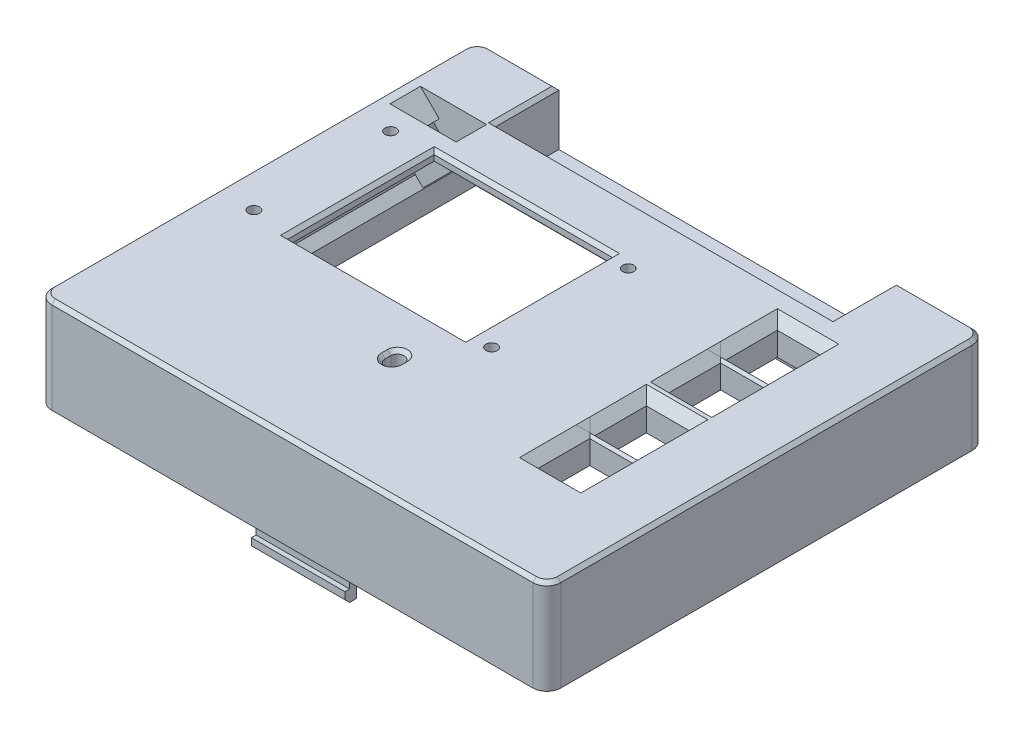
from build123d import *

# Parameters (mm, degrees)
SKETCH1_W            = 108.81
SKETCH1_H            = 93.91
BOSS_EXTRUDE1_DEPTH  = 3
SKETCH2_W            = 108.81
SKETCH2_H            = 93.91
SKETCH2_W_2          = 102.81
SKETCH2_H_2          = 87.91
BOSS_EXTRUDE2_DEPTH  = 17.259
BOSS_EXTRUDE3_DEPTH  = 10
CHAMFER1_SIZE        = 1
CUT_EXTRUDE1_REACH   = 123.742
SKETCH8_W            = 11.62
SKETCH8_H            = 53.615769541
BOSS_EXTRUDE4_DEPTH  = 7
SKETCH9_W            = 9.12
SKETCH9_H            = 11.025
CUT_EXTRUDE2_DEPTH   = 78.572798912
SKETCH10_W           = 72.135
SKETCH10_H           = 7.477
CUT_EXTRUDE3_DEPTH   = 78.572798912
SKETCH11_W           = 72.135
SKETCH11_H           = 6.0665
CUT_EXTRUDE4_DEPTH   = 11.716
CUT_EXTRUDE5_DEPTH   = 1.0495
SKETCH14_W           = 38.1
SKETCH14_H           = 31.3563
CUT_EXTRUDE6_DEPTH   = 78.572798912
BOSS_EXTRUDE5_DEPTH  = 1.7826
BOSS_EXTRUDE8_DEPTH  = 8.716
BOSS_EXTRUDE6_START  = -33.395
BOSS_EXTRUDE6_DEPTH  = 9
SKETCH17_W           = 9
SKETCH17_H           = 12.19950426
BOSS_EXTRUDE7_DEPTH  = 2
CUT_EXTRUDE7_DEPTH   = 104.117373354
CUT_EXTRUDE9_REACH   = 92.638
SKETCH20_W           = 6.5
SKETCH20_H           = 5.8
BOSS_EXTRUDE9_DEPTH  = 9.159
CUT_EXTRUDE10_DEPTH  = 78.572798912
CHAMFER2_SIZE        = 2
M2_CLEARANCE_HOLE1_D = 2.4
FILLET1_R            = 3
CHAMFER3_SIZE        = 0.75
CUT_EXTRUDE11_REACH  = 123.742
SKETCH26_W           = 38.225000066
SKETCH26_H           = 7.61
SKETCH27_W           = 6
SKETCH27_H           = 6.5
CUT_EXTRUDE12_DEPTH  = 78.572798912


# Read off the part's stored shape, not the designer's step: Boss-Extrude6
with BuildPart() as part:
    # Sketch1 → Boss-Extrude1 (new body)
    with BuildSketch(Plane(origin=(0, 27.869, 0), x_dir=(-1, 0, 0), z_dir=(0, -1, 0))):
        with Locations((-1, 0)):
            Rectangle(SKETCH1_W, SKETCH1_H)
    extrude(amount=BOSS_EXTRUDE1_DEPTH)

    # Sketch2 → Boss-Extrude2 (add)
    with BuildSketch(Plane.XZ.offset(-24.869)):
        with Locations((1, 0)):
            Rectangle(SKETCH2_W, SKETCH2_H)
        with Locations((1, 0)):
            Rectangle(SKETCH2_W_2, SKETCH2_H_2, mode=Mode.SUBTRACT)
    extrude(amount=BOSS_EXTRUDE2_DEPTH)

    # Sketch4 → Boss-Extrude3 (add, symmetric)
    with BuildSketch(Plane.ZY):
        Polygon((-43.955, 12.36), (-42.205, 10.61), (-42.205, 0.61), (-43.705, 0.61), (-44.705, 1.61), (-44.705, 3.11), (-43.705, 3.11), (-43.705, 7.61), (-43.955, 7.61), align=None)
    boss_extrude3 = extrude(amount=BOSS_EXTRUDE3_DEPTH, both=True)

    # Mirror1: Boss-Extrude3 across plane
    add(boss_extrude3.mirror(Plane.XY))

    # Sweep1: sweep along a path in Sketch6
    with BuildLine(Plane.XZ.offset(-7.61)) as sweep1_path:
        Line((52.405, -43.955), (52.405, 43.955))
        Line((52.405, 43.955), (-50.405, 43.955))
        Line((-50.405, 43.955), (-50.405, -43.955))
        Line((-50.405, -43.955), (52.405, -43.955))
    # Sketch5 → Sweep1 (sweep)
    with BuildSketch(Plane.ZY):
        Polygon((-43.955, 7.61), (-43.705, 7.61), (-43.705, 5.61), (-42.205, 5.61), (-42.205, 10.61), (-43.955, 12.36), align=None)
    sweep(path=sweep1_path.line, transition=Transition.RIGHT)

    # Chamfer1
    chamfer1_edges = [part.edges().sort_by_distance(p)[0] for p in [
        (31.0775, 5.61, -43.705),
        (31.0775, 5.61, 43.705),
        (52.155, 5.61, 0),
        (-30.0775, 5.61, -43.705),
        (-30.0775, 5.61, 43.705),
        (-50.155, 5.61, 0),
    ]]
    chamfer(chamfer1_edges, length=CHAMFER1_SIZE)

    # Sketch7 → Cut-Extrude1 (cut, up to next)
    with BuildSketch(Plane.ZY.offset(53.405), mode=Mode.PRIVATE) as cut_extrude1_sk1:
        with BuildLine():
            Line((17.410956444, 19.809997782), (23.975613479, 19.809997782))
            ThreePointArc((23.975613479, 19.809997782), (28.225611261, 15.56), (23.975613479, 11.310002218))
            Line((23.975613479, 11.310002218), (17.410956444, 11.310002218))
            ThreePointArc((17.410956444, 11.310002218), (13.160958662, 15.56), (17.410956444, 19.809997782))
        make_face()
    cut_extrude1_tool1 = extrude(cut_extrude1_sk1.sketch, amount=-CUT_EXTRUDE1_REACH, mode=Mode.PRIVATE) & part.part
    add(cut_extrude1_tool1.solids().sort_by_distance((-53.405, 15.56, 20.693285))[0], mode=Mode.SUBTRACT)

    # Sketch8 → Boss-Extrude4 (add)
    with BuildSketch(Plane(origin=(0, 27.869, 0), x_dir=(1, 0, 0), z_dir=(0, 1, 0))):
        with Locations((35.146783972, 1.567317421)):
            Rectangle(SKETCH8_W, SKETCH8_H)
    extrude(amount=-BOSS_EXTRUDE4_DEPTH)

    # Sketch9 → Cut-Extrude2 (cut, through all)
    with BuildSketch(Plane(origin=(0, 27.869, 0), x_dir=(1, 0, 0), z_dir=(0, 1, 0))):
        with Locations((35.146783972, 9.500245453)):
            Rectangle(SKETCH9_W, SKETCH9_H)
        with Locations((35.146783972, 21.612702191)):
            Rectangle(SKETCH9_W, SKETCH9_H)
        with Locations((35.146783972, -18.47806735)):
            Rectangle(SKETCH9_W, SKETCH9_H)
        with Locations((35.146783972, -6.378211363)):
            Rectangle(SKETCH9_W, SKETCH9_H)
    extrude(amount=-CUT_EXTRUDE2_DEPTH, mode=Mode.SUBTRACT)

    # Sketch10 → Cut-Extrude3 (cut, through all)
    with BuildSketch(Plane(origin=(0, 27.869, 0), x_dir=(1, 0, 0), z_dir=(0, 1, 0))):
        with Locations((0.125, 37.15)):
            Rectangle(SKETCH10_W, SKETCH10_H)
    extrude(amount=-CUT_EXTRUDE3_DEPTH, mode=Mode.SUBTRACT)

    # Sketch11 → Cut-Extrude4 (cut)
    with BuildSketch(Plane(origin=(0, 27.869, 0), x_dir=(1, 0, 0), z_dir=(0, 1, 0))):
        with Locations((0.125, 43.92175)):
            Rectangle(SKETCH11_W, SKETCH11_H)
    extrude(amount=-CUT_EXTRUDE4_DEPTH, mode=Mode.SUBTRACT)

    # Sketch13 → Cut-Extrude5 (cut)
    with BuildSketch(Plane.XZ.offset(-24.869)):
        Polygon((3.157, 12.11), (-45.3504, 12.11), (-45.3504, 7.3668), (-43.9341, 7.3668), (-43.9341, -19.4368), (-45.3504, -19.4368), (-45.3504, -24.18), (3.157, -24.18), align=None)
    extrude(amount=-CUT_EXTRUDE5_DEPTH, mode=Mode.SUBTRACT)

    # Sketch14 → Cut-Extrude6 (cut, through all)
    with BuildSketch(Plane(origin=(0, 27.869, 0), x_dir=(1, 0, 0), z_dir=(0, 1, 0))):
        with Locations((-18.29, 6.035)):
            Rectangle(SKETCH14_W, SKETCH14_H)
    extrude(amount=-CUT_EXTRUDE6_DEPTH, mode=Mode.SUBTRACT)

    # Sketch15 → Boss-Extrude5 (add)
    with BuildSketch(Plane.XZ.offset(-24.869)):
        with BuildLine():
            Line((-45.3504, 11.11), (-45.3504, 7.3668))
            Line((-45.3504, 7.3668), (-45.3504, -19.4368))
            Line((-45.3504, -19.4368), (-45.3504, -23.18))
            Line((-45.3504, -23.18), (-45.595, -23.18))
            ThreePointArc((-45.595, -23.18), (-47.391051224, -22.436051224), (-48.135, -20.64))
            Line((-48.135, -20.64), (-48.135, 8.57))
            ThreePointArc((-48.135, 8.57), (-47.391051224, 10.366051224), (-45.595, 11.11))
            Line((-45.595, 11.11), (-45.3504, 11.11))
        make_face()
        with BuildLine():
            Line((5.205, 11.11), (3.157, 11.11))
            Line((3.157, 11.11), (3.157, -23.18))
            Line((3.157, -23.18), (5.205, -23.18))
            ThreePointArc((5.205, -23.18), (7.001051224, -22.436051224), (7.745, -20.64))
            Line((7.745, -20.64), (7.745, 8.57))
            ThreePointArc((7.745, 8.57), (7.001051224, 10.366051224), (5.205, 11.11))
        make_face()
    extrude(amount=BOSS_EXTRUDE5_DEPTH)

    # Sketch21 → Boss-Extrude8 (add)
    with BuildSketch(Plane.XZ.offset(-24.869)):
        Polygon((-35.9425, -33.4115), (-35.9425, -43.955), (-37.9425, -43.955), (-37.9425, -31.4115), (38.1925, -31.4115), (38.1925, -43.955), (36.1925, -43.955), (36.1925, -33.4115), align=None)
    extrude(amount=BOSS_EXTRUDE8_DEPTH)

    # Boss-Extrude6 outline → Boss-Extrude6 (add)
    with BuildSketch(Plane.XY.offset(BOSS_EXTRUDE6_START)):
        Polygon((-50.195204379, 24.869), (-43.830013524, 18.503809145), (-37.464822668, 24.869), align=None)
    extrude(amount=BOSS_EXTRUDE6_DEPTH)

    # Sketch17 → Boss-Extrude7 (add)
    with BuildSketch(Plane(origin=(-31.166911334, 31.166911334, 0), x_dir=(0, 0, -1), z_dir=(0.7071067811865506, -0.7071067811865446, 0))):
        with Locations((28.895, -11.808578728)):
            Rectangle(SKETCH17_W, SKETCH17_H)
    extrude(amount=BOSS_EXTRUDE7_DEPTH)

    # Sketch18 → Cut-Extrude7 (cut, through all)
    with BuildSketch(Plane(origin=(-31.166911334, 31.166911334, 0), x_dir=(0, 0, -1), z_dir=(0.7071067811865509, -0.7071067811865442, 0))):
        Polygon((32.145, -14.658330858), (32.145, -6.158330858), (25.645, -6.158330858), (25.645, -14.658330858), (25.645, -16.158330858), (32.145, -16.158330858), align=None)
    extrude(amount=-CUT_EXTRUDE7_DEPTH, mode=Mode.SUBTRACT)

    # Sketch20 → Cut-Extrude9 (cut, up to next)
    with BuildSketch(Plane(origin=(-11.425665323, -11.425665323, 0), x_dir=(0, 0, -1), z_dir=(0.7071067811865442, 0.7071067811865508, 0)), mode=Mode.PRIVATE) as cut_extrude9_sk1:
        with Locations((28.895, 46.976668706)):
            Rectangle(SKETCH20_W, SKETCH20_H)
    cut_extrude9_tool1 = extrude(cut_extrude9_sk1.sketch, amount=-CUT_EXTRUDE9_REACH, mode=Mode.PRIVATE) & part.part
    add(cut_extrude9_tool1.solids().sort_by_distance((-44.643186, 21.791856, -28.895))[0], mode=Mode.SUBTRACT)

    # Sketch22 → Boss-Extrude9 (add)
    with BuildSketch(Plane(origin=(0, 27.869, 0), x_dir=(1, 0, 0), z_dir=(0, 1, 0))):
        with BuildLine():
            Line((0.078028502, -21.361475732), (0.083092707, -20.161486418))
            ThreePointArc((0.083092707, -20.161486418), (-3.328806796, -16.72066701), (-6.769626204, -20.132566513))
            Line((-6.769626204, -20.132566513), (-6.774690409, -21.332555827))
            ThreePointArc((-6.774690409, -21.332555827), (-3.362790906, -24.773375235), (0.078028502, -21.361475732))
        make_face()
    extrude(amount=-BOSS_EXTRUDE9_DEPTH)

    # Sketch23 → Cut-Extrude10 (cut, through all)
    with BuildSketch(Plane(origin=(0, 27.869, 0), x_dir=(1, 0, 0), z_dir=(0, 1, 0))):
        with BuildLine():
            Line((-1.921953688, -21.35303539), (-1.916889483, -20.153046075))
            ThreePointArc((-1.916889483, -20.153046075), (-3.337247138, -18.7206492), (-4.769644014, -20.141006856))
            Line((-4.769644014, -20.141006856), (-4.774708219, -21.34099617))
            ThreePointArc((-4.774708219, -21.34099617), (-3.354350564, -22.773393045), (-1.921953688, -21.35303539))
        make_face()
    extrude(amount=-CUT_EXTRUDE10_DEPTH, mode=Mode.SUBTRACT)

    # Chamfer2
    # the kernel refuses this chamfer: 2 mm, written as the material it takes off along each edge
    with BuildSketch(Plane(origin=(30.586783972, 27.869, -27.125202191), x_dir=(-0.9996219169112968, 0.027495876610585647, 0), z_dir=(0, 0, 1)), Plane(origin=(39.706783972, 27.869, -16.100202191), x_dir=(0.9996219169112968, 0.027495876610585647, 0), z_dir=(0, 0, -1)), Plane(origin=(30.586783972, 27.869, 12.96556735), x_dir=(-0.9996219169112968, 0.027495876610585647, 0), z_dir=(0, 0, 1)), Plane(origin=(39.706783972, 27.869, 23.99056735), x_dir=(0.9996219169112968, 0.027495876610585647, 0), z_dir=(0, 0, -1)), Plane(origin=(30.586783972, 27.869, 0.865711363), x_dir=(-0.9996219169112968, 0.027495876610585647, 0), z_dir=(0, 0, 1)), Plane(origin=(39.706783972, 27.869, 11.890711363), x_dir=(0.9996219169112968, 0.02749587661058392, 0), z_dir=(0, 0, -1)), Plane(origin=(39.706783972, 27.869, -3.987745453), x_dir=(0.9996219169112968, 0.027495876610585647, 0), z_dir=(0, 0, -1)), Plane(origin=(30.586783972, 27.869, -15.012745453), x_dir=(-0.9996219169112968, 0.027495876610585647, 0), z_dir=(0, 0, 1))) as chamfer2_piece_1:
        Polygon((CHAMFER2_SIZE * 0.999621916911, CHAMFER2_SIZE * 0.0274958766106), (-CHAMFER2_SIZE * 0.0274958766106, CHAMFER2_SIZE * 0.999621916911), (0, 0), align=None)
    extrude(amount=11.025, mode=Mode.SUBTRACT)
    with BuildSketch(Plane(origin=(30.586783972, 27.869, -27.125202191), x_dir=(-0.9996219169112968, 0.027495876610585647, 0), z_dir=(0, 0, 1))) as chamfer2_piece_2_section:
        Polygon((CHAMFER2_SIZE * 0.999621916911, CHAMFER2_SIZE * 0.0274958766106), (-CHAMFER2_SIZE * 0.0274958766106, CHAMFER2_SIZE * 0.999621916911), (0, 0), align=None)
    chamfer2_piece_2 = extrude(amount=16.168365976, mode=Mode.PRIVATE)
    chamfer2_piece_2 = split(chamfer2_piece_2, bisect_by=Plane(origin=(29.927196718, 27.209412746, -15.012745453), z_dir=(0, 0, 1)), keep=Keep.TOP, mode=Mode.PRIVATE)
    add(chamfer2_piece_2, mode=Mode.SUBTRACT)
    with BuildSketch(Plane(origin=(30.586783972, 27.869, -16.100202191), x_dir=(0, 0.027495876610585623, 0.9996219169112968), z_dir=(1, 0, 0)), Plane(origin=(39.706783972, 27.869, -27.125202191), x_dir=(0, 0.027495876610585696, -0.9996219169112968), z_dir=(-1, 0, 0)), Plane(origin=(30.586783972, 27.869, 23.99056735), x_dir=(0, 0.0274958766105856, 0.9996219169112968), z_dir=(1, 0, 0)), Plane(origin=(39.706783972, 27.869, 12.96556735), x_dir=(0, 0.02749587661058735, -0.9996219169112968), z_dir=(-1, 0, 0)), Plane(origin=(30.586783972, 27.869, 11.890711363), x_dir=(0, 0.027495876610583895, 0.9996219169112968), z_dir=(1, 0, 0)), Plane(origin=(39.706783972, 27.869, 0.865711363), x_dir=(0, 0.027495876610585623, -0.9996219169112968), z_dir=(-1, 0, 0)), Plane(origin=(30.586783972, 27.869, -3.987745453), x_dir=(0, 0.027495876610585623, 0.9996219169112968), z_dir=(1, 0, 0)), Plane(origin=(39.706783972, 27.869, -15.012745453), x_dir=(0, 0.027495876610585716, -0.9996219169112968), z_dir=(-1, 0, 0))) as chamfer2_piece_3:
        Polygon((CHAMFER2_SIZE * 0.999621916911, CHAMFER2_SIZE * 0.0274958766106), (-CHAMFER2_SIZE * 0.0274958766106, CHAMFER2_SIZE * 0.999621916911), (0, 0), align=None)
    extrude(amount=9.12, mode=Mode.SUBTRACT)
    with BuildSketch(Plane(origin=(39.706783972, 27.869, -10.956836215), x_dir=(0.9996219169112968, 0.027495876610585647, 0), z_dir=(0, 0, -1))) as chamfer2_piece_4_section:
        Polygon((CHAMFER2_SIZE * 0.999621916911, CHAMFER2_SIZE * 0.0274958766106), (-CHAMFER2_SIZE * 0.0274958766106, CHAMFER2_SIZE * 0.999621916911), (0, 0), align=None)
    chamfer2_piece_4 = extrude(amount=16.168365976, mode=Mode.PRIVATE)
    chamfer2_piece_4 = split(chamfer2_piece_4, bisect_by=Plane(origin=(40.366371226, 27.209412746, -15.012745453), z_dir=(0, 0, 1)), keep=Keep.TOP, mode=Mode.PRIVATE)
    add(chamfer2_piece_4, mode=Mode.SUBTRACT)
    with BuildSketch(Plane(origin=(30.586783972, 27.869, 7.822201374), x_dir=(-0.9996219169112968, 0.027495876610585647, 0), z_dir=(0, 0, 1))) as chamfer2_piece_5_section:
        Polygon((CHAMFER2_SIZE * 0.999621916911, CHAMFER2_SIZE * 0.0274958766106), (-CHAMFER2_SIZE * 0.0274958766106, CHAMFER2_SIZE * 0.999621916911), (0, 0), align=None)
    chamfer2_piece_5 = extrude(amount=16.168365976, mode=Mode.PRIVATE)
    chamfer2_piece_5 = split(chamfer2_piece_5, bisect_by=Plane(origin=(29.927196718, 27.209412746, 11.890711363), z_dir=(0, 0, -1)), keep=Keep.TOP, mode=Mode.PRIVATE)
    add(chamfer2_piece_5, mode=Mode.SUBTRACT)
    with BuildSketch(Plane(origin=(39.706783972, 27.869, 23.99056735), x_dir=(0.9996219169112968, 0.027495876610585647, 0), z_dir=(0, 0, -1))) as chamfer2_piece_6_section:
        Polygon((CHAMFER2_SIZE * 0.999621916911, CHAMFER2_SIZE * 0.0274958766106), (-CHAMFER2_SIZE * 0.0274958766106, CHAMFER2_SIZE * 0.999621916911), (0, 0), align=None)
    chamfer2_piece_6 = extrude(amount=16.168365976, mode=Mode.PRIVATE)
    chamfer2_piece_6 = split(chamfer2_piece_6, bisect_by=Plane(origin=(40.366371226, 27.209412746, 11.890711363), z_dir=(0, 0, -1)), keep=Keep.TOP, mode=Mode.PRIVATE)
    add(chamfer2_piece_6, mode=Mode.SUBTRACT)
    with BuildSketch(Plane(origin=(30.586783972, 27.869, -4.277654613), x_dir=(-0.9996219169112968, 0.027495876610585647, 0), z_dir=(0, 0, 1))) as chamfer2_piece_7_section:
        Polygon((CHAMFER2_SIZE * 0.999621916911, CHAMFER2_SIZE * 0.0274958766106), (-CHAMFER2_SIZE * 0.0274958766106, CHAMFER2_SIZE * 0.999621916911), (0, 0), align=None)
    chamfer2_piece_7 = extrude(amount=16.168365976, mode=Mode.PRIVATE)
    chamfer2_piece_7 = split(chamfer2_piece_7, bisect_by=Plane(origin=(29.927196718, 27.209412746, -3.987745453), z_dir=(0, 0, -1)), keep=Keep.TOP, mode=Mode.PRIVATE)
    add(chamfer2_piece_7, mode=Mode.SUBTRACT)
    with BuildSketch(Plane(origin=(30.586783972, 27.869, 0.865711363), x_dir=(-0.9996219169112968, 0.027495876610585647, 0), z_dir=(0, 0, 1))) as chamfer2_piece_8_section:
        Polygon((CHAMFER2_SIZE * 0.999621916911, CHAMFER2_SIZE * 0.0274958766106), (-CHAMFER2_SIZE * 0.0274958766106, CHAMFER2_SIZE * 0.999621916911), (0, 0), align=None)
    chamfer2_piece_8 = extrude(amount=16.168365976, mode=Mode.PRIVATE)
    chamfer2_piece_8 = split(chamfer2_piece_8, bisect_by=Plane(origin=(29.927196718, 27.209412746, 12.96556735), z_dir=(0, 0, 1)), keep=Keep.TOP, mode=Mode.PRIVATE)
    add(chamfer2_piece_8, mode=Mode.SUBTRACT)
    with BuildSketch(Plane(origin=(39.706783972, 27.869, 17.034077339), x_dir=(0.9996219169112968, 0.027495876610585647, 0), z_dir=(0, 0, -1))) as chamfer2_piece_9_section:
        Polygon((CHAMFER2_SIZE * 0.999621916911, CHAMFER2_SIZE * 0.0274958766106), (-CHAMFER2_SIZE * 0.0274958766106, CHAMFER2_SIZE * 0.999621916911), (0, 0), align=None)
    chamfer2_piece_9 = extrude(amount=16.168365976, mode=Mode.PRIVATE)
    chamfer2_piece_9 = split(chamfer2_piece_9, bisect_by=Plane(origin=(40.366371226, 27.209412746, 12.96556735), z_dir=(0, 0, 1)), keep=Keep.TOP, mode=Mode.PRIVATE)
    add(chamfer2_piece_9, mode=Mode.SUBTRACT)
    with BuildSketch(Plane(origin=(39.706783972, 27.869, 11.890711363), x_dir=(0.9996219169112968, 0.02749587661058392, 0), z_dir=(0, 0, -1))) as chamfer2_piece_10_section:
        Polygon((CHAMFER2_SIZE * 0.999621916911, CHAMFER2_SIZE * 0.0274958766106), (-CHAMFER2_SIZE * 0.0274958766106, CHAMFER2_SIZE * 0.999621916911), (0, 0), align=None)
    chamfer2_piece_10 = extrude(amount=16.168365976, mode=Mode.PRIVATE)
    chamfer2_piece_10 = split(chamfer2_piece_10, bisect_by=Plane(origin=(40.366371226, 27.209412746, -3.987745453), z_dir=(0, 0, -1)), keep=Keep.TOP, mode=Mode.PRIVATE)
    add(chamfer2_piece_10, mode=Mode.SUBTRACT)
    with BuildSketch(Plane(origin=(39.706783972, 27.869, 1.155620523), x_dir=(0.9996219169112968, 0.027495876610585647, 0), z_dir=(0, 0, -1))) as chamfer2_piece_11_section:
        Polygon((CHAMFER2_SIZE * 0.999621916911, CHAMFER2_SIZE * 0.0274958766106), (-CHAMFER2_SIZE * 0.0274958766106, CHAMFER2_SIZE * 0.999621916911), (0, 0), align=None)
    chamfer2_piece_11 = extrude(amount=16.168365976, mode=Mode.PRIVATE)
    chamfer2_piece_11 = split(chamfer2_piece_11, bisect_by=Plane(origin=(40.366371226, 27.209412746, 0.865711363), z_dir=(0, 0, 1)), keep=Keep.TOP, mode=Mode.PRIVATE)
    add(chamfer2_piece_11, mode=Mode.SUBTRACT)
    with BuildSketch(Plane(origin=(39.706783972, 27.869, -3.987745453), x_dir=(0.9996219169112968, 0.027495876610585647, 0), z_dir=(0, 0, -1))) as chamfer2_piece_12_section:
        Polygon((CHAMFER2_SIZE * 0.999621916911, CHAMFER2_SIZE * 0.0274958766106), (-CHAMFER2_SIZE * 0.0274958766106, CHAMFER2_SIZE * 0.999621916911), (0, 0), align=None)
    chamfer2_piece_12 = extrude(amount=16.168365976, mode=Mode.PRIVATE)
    chamfer2_piece_12 = split(chamfer2_piece_12, bisect_by=Plane(origin=(40.366371226, 27.209412746, -16.100202191), z_dir=(0, 0, -1)), keep=Keep.TOP, mode=Mode.PRIVATE)
    add(chamfer2_piece_12, mode=Mode.SUBTRACT)
    with BuildSketch(Plane(origin=(30.586783972, 27.869, -20.156111429), x_dir=(-0.9996219169112968, 0.027495876610585647, 0), z_dir=(0, 0, 1))) as chamfer2_piece_13_section:
        Polygon((CHAMFER2_SIZE * 0.999621916911, CHAMFER2_SIZE * 0.0274958766106), (-CHAMFER2_SIZE * 0.0274958766106, CHAMFER2_SIZE * 0.999621916911), (0, 0), align=None)
    chamfer2_piece_13 = extrude(amount=16.168365976, mode=Mode.PRIVATE)
    chamfer2_piece_13 = split(chamfer2_piece_13, bisect_by=Plane(origin=(29.927196718, 27.209412746, -16.100202191), z_dir=(0, 0, -1)), keep=Keep.TOP, mode=Mode.PRIVATE)
    add(chamfer2_piece_13, mode=Mode.SUBTRACT)
    with BuildSketch(Plane(origin=(30.586783972, 27.869, -15.012745453), x_dir=(-0.9996219169112968, 0.027495876610585647, 0), z_dir=(0, 0, 1))) as chamfer2_piece_14_section:
        Polygon((CHAMFER2_SIZE * 0.999621916911, CHAMFER2_SIZE * 0.0274958766106), (-CHAMFER2_SIZE * 0.0274958766106, CHAMFER2_SIZE * 0.999621916911), (0, 0), align=None)
    chamfer2_piece_14 = extrude(amount=16.168365976, mode=Mode.PRIVATE)
    chamfer2_piece_14 = split(chamfer2_piece_14, bisect_by=Plane(origin=(29.927196718, 27.209412746, 0.865711363), z_dir=(0, 0, 1)), keep=Keep.TOP, mode=Mode.PRIVATE)
    add(chamfer2_piece_14, mode=Mode.SUBTRACT)
    with BuildSketch(Plane(origin=(30.586783972, 27.869, -32.268568167), x_dir=(-0.9996219169112968, 0.027495876610585647, 0), z_dir=(0, 0, 1))) as chamfer2_piece_15a_section:
        Polygon((CHAMFER2_SIZE * 0.999621916911, CHAMFER2_SIZE * 0.0274958766106), (-CHAMFER2_SIZE * 0.0274958766106, CHAMFER2_SIZE * 0.999621916911), (0, 0), align=None)
    chamfer2_piece_15a = extrude(amount=16.168365976, mode=Mode.PRIVATE)
    chamfer2_piece_15a = split(chamfer2_piece_15a, bisect_by=Plane(origin=(29.927196718, 27.209412746, -27.125202191), z_dir=(0, 0, -1)), keep=Keep.TOP, mode=Mode.PRIVATE)
    with BuildSketch(Plane(origin=(39.706783972, 27.869, -27.125202191), x_dir=(0, 0.027495876610585696, -0.9996219169112968), z_dir=(-1, 0, 0))) as chamfer2_piece_15b_section:
        Polygon((CHAMFER2_SIZE * 0.999621916911, CHAMFER2_SIZE * 0.0274958766106), (-CHAMFER2_SIZE * 0.0274958766106, CHAMFER2_SIZE * 0.999621916911), (0, 0), align=None)
    chamfer2_piece_15b = extrude(amount=14.263365976, mode=Mode.PRIVATE)
    chamfer2_piece_15b = split(chamfer2_piece_15b, bisect_by=Plane(origin=(30.586783972, 27.209412746, -27.784789445), z_dir=(-1, 0, 0)), keep=Keep.TOP, mode=Mode.PRIVATE)
    chamfer2_piece_15 = chamfer2_piece_15a & chamfer2_piece_15b
    add(chamfer2_piece_15, mode=Mode.SUBTRACT)
    with BuildSketch(Plane(origin=(25.443417996, 27.869, -16.100202191), x_dir=(0, 0.027495876610585623, 0.9996219169112968), z_dir=(1, 0, 0))) as chamfer2_piece_16a_section:
        Polygon((CHAMFER2_SIZE * 0.999621916911, CHAMFER2_SIZE * 0.0274958766106), (-CHAMFER2_SIZE * 0.0274958766106, CHAMFER2_SIZE * 0.999621916911), (0, 0), align=None)
    chamfer2_piece_16a = extrude(amount=14.263365976, mode=Mode.PRIVATE)
    chamfer2_piece_16a = split(chamfer2_piece_16a, bisect_by=Plane(origin=(30.586783972, 27.209412746, -15.440614938), z_dir=(-1, 0, 0)), keep=Keep.TOP, mode=Mode.PRIVATE)
    with BuildSketch(Plane(origin=(30.586783972, 27.869, -27.125202191), x_dir=(-0.9996219169112968, 0.027495876610585647, 0), z_dir=(0, 0, 1))) as chamfer2_piece_16b_section:
        Polygon((CHAMFER2_SIZE * 0.999621916911, CHAMFER2_SIZE * 0.0274958766106), (-CHAMFER2_SIZE * 0.0274958766106, CHAMFER2_SIZE * 0.999621916911), (0, 0), align=None)
    chamfer2_piece_16b = extrude(amount=16.168365976, mode=Mode.PRIVATE)
    chamfer2_piece_16b = split(chamfer2_piece_16b, bisect_by=Plane(origin=(29.927196718, 27.209412746, -15.012745453), z_dir=(0, 0, -1)), keep=Keep.TOP, mode=Mode.PRIVATE)
    chamfer2_piece_16b = split(chamfer2_piece_16b, bisect_by=Plane(origin=(29.927196718, 27.209412746, -16.100202191), z_dir=(0, 0, 1)), keep=Keep.TOP, mode=Mode.PRIVATE)
    chamfer2_piece_16 = chamfer2_piece_16a & chamfer2_piece_16b
    add(chamfer2_piece_16, mode=Mode.SUBTRACT)
    with BuildSketch(Plane(origin=(30.586783972, 27.869, -16.100202191), x_dir=(0, 0.027495876610585623, 0.9996219169112968), z_dir=(1, 0, 0))) as chamfer2_piece_17a_section:
        Polygon((CHAMFER2_SIZE * 0.999621916911, CHAMFER2_SIZE * 0.0274958766106), (-CHAMFER2_SIZE * 0.0274958766106, CHAMFER2_SIZE * 0.999621916911), (0, 0), align=None)
    chamfer2_piece_17a = extrude(amount=14.263365976, mode=Mode.PRIVATE)
    chamfer2_piece_17a = split(chamfer2_piece_17a, bisect_by=Plane(origin=(39.706783972, 27.209412746, -15.440614938), z_dir=(1, 0, 0)), keep=Keep.TOP, mode=Mode.PRIVATE)
    with BuildSketch(Plane(origin=(39.706783972, 27.869, -10.956836215), x_dir=(0.9996219169112968, 0.027495876610585647, 0), z_dir=(0, 0, -1))) as chamfer2_piece_17b_section:
        Polygon((CHAMFER2_SIZE * 0.999621916911, CHAMFER2_SIZE * 0.0274958766106), (-CHAMFER2_SIZE * 0.0274958766106, CHAMFER2_SIZE * 0.999621916911), (0, 0), align=None)
    chamfer2_piece_17b = extrude(amount=16.168365976, mode=Mode.PRIVATE)
    chamfer2_piece_17b = split(chamfer2_piece_17b, bisect_by=Plane(origin=(40.366371226, 27.209412746, -15.012745453), z_dir=(0, 0, -1)), keep=Keep.TOP, mode=Mode.PRIVATE)
    chamfer2_piece_17b = split(chamfer2_piece_17b, bisect_by=Plane(origin=(40.366371226, 27.209412746, -16.100202191), z_dir=(0, 0, 1)), keep=Keep.TOP, mode=Mode.PRIVATE)
    chamfer2_piece_17 = chamfer2_piece_17a & chamfer2_piece_17b
    add(chamfer2_piece_17, mode=Mode.SUBTRACT)
    with BuildSketch(Plane(origin=(39.706783972, 27.869, -16.100202191), x_dir=(0.9996219169112968, 0.027495876610585647, 0), z_dir=(0, 0, -1))) as chamfer2_piece_18a_section:
        Polygon((CHAMFER2_SIZE * 0.999621916911, CHAMFER2_SIZE * 0.0274958766106), (-CHAMFER2_SIZE * 0.0274958766106, CHAMFER2_SIZE * 0.999621916911), (0, 0), align=None)
    chamfer2_piece_18a = extrude(amount=16.168365976, mode=Mode.PRIVATE)
    chamfer2_piece_18a = split(chamfer2_piece_18a, bisect_by=Plane(origin=(40.366371226, 27.209412746, -27.125202191), z_dir=(0, 0, -1)), keep=Keep.TOP, mode=Mode.PRIVATE)
    with BuildSketch(Plane(origin=(44.850149948, 27.869, -27.125202191), x_dir=(0, 0.027495876610585696, -0.9996219169112968), z_dir=(-1, 0, 0))) as chamfer2_piece_18b_section:
        Polygon((CHAMFER2_SIZE * 0.999621916911, CHAMFER2_SIZE * 0.0274958766106), (-CHAMFER2_SIZE * 0.0274958766106, CHAMFER2_SIZE * 0.999621916911), (0, 0), align=None)
    chamfer2_piece_18b = extrude(amount=14.263365976, mode=Mode.PRIVATE)
    chamfer2_piece_18b = split(chamfer2_piece_18b, bisect_by=Plane(origin=(39.706783972, 27.209412746, -27.784789445), z_dir=(1, 0, 0)), keep=Keep.TOP, mode=Mode.PRIVATE)
    chamfer2_piece_18 = chamfer2_piece_18a & chamfer2_piece_18b
    add(chamfer2_piece_18, mode=Mode.SUBTRACT)
    with BuildSketch(Plane(origin=(30.586783972, 27.869, 7.822201374), x_dir=(-0.9996219169112968, 0.027495876610585647, 0), z_dir=(0, 0, 1))) as chamfer2_piece_19a_section:
        Polygon((CHAMFER2_SIZE * 0.999621916911, CHAMFER2_SIZE * 0.0274958766106), (-CHAMFER2_SIZE * 0.0274958766106, CHAMFER2_SIZE * 0.999621916911), (0, 0), align=None)
    chamfer2_piece_19a = extrude(amount=16.168365976, mode=Mode.PRIVATE)
    chamfer2_piece_19a = split(chamfer2_piece_19a, bisect_by=Plane(origin=(29.927196718, 27.209412746, 12.96556735), z_dir=(0, 0, -1)), keep=Keep.TOP, mode=Mode.PRIVATE)
    chamfer2_piece_19a = split(chamfer2_piece_19a, bisect_by=Plane(origin=(29.927196718, 27.209412746, 11.890711363), z_dir=(0, 0, 1)), keep=Keep.TOP, mode=Mode.PRIVATE)
    with BuildSketch(Plane(origin=(39.706783972, 27.869, 12.96556735), x_dir=(0, 0.02749587661058735, -0.9996219169112968), z_dir=(-1, 0, 0))) as chamfer2_piece_19b_section:
        Polygon((CHAMFER2_SIZE * 0.999621916911, CHAMFER2_SIZE * 0.0274958766106), (-CHAMFER2_SIZE * 0.0274958766106, CHAMFER2_SIZE * 0.999621916911), (0, 0), align=None)
    chamfer2_piece_19b = extrude(amount=14.263365976, mode=Mode.PRIVATE)
    chamfer2_piece_19b = split(chamfer2_piece_19b, bisect_by=Plane(origin=(30.586783972, 27.209412746, 12.305980096), z_dir=(-1, 0, 0)), keep=Keep.TOP, mode=Mode.PRIVATE)
    chamfer2_piece_19 = chamfer2_piece_19a & chamfer2_piece_19b
    add(chamfer2_piece_19, mode=Mode.SUBTRACT)
    with BuildSketch(Plane(origin=(25.443417996, 27.869, 23.99056735), x_dir=(0, 0.0274958766105856, 0.9996219169112968), z_dir=(1, 0, 0))) as chamfer2_piece_20a_section:
        Polygon((CHAMFER2_SIZE * 0.999621916911, CHAMFER2_SIZE * 0.0274958766106), (-CHAMFER2_SIZE * 0.0274958766106, CHAMFER2_SIZE * 0.999621916911), (0, 0), align=None)
    chamfer2_piece_20a = extrude(amount=14.263365976, mode=Mode.PRIVATE)
    chamfer2_piece_20a = split(chamfer2_piece_20a, bisect_by=Plane(origin=(30.586783972, 27.209412746, 24.650154603), z_dir=(-1, 0, 0)), keep=Keep.TOP, mode=Mode.PRIVATE)
    with BuildSketch(Plane(origin=(30.586783972, 27.869, 12.96556735), x_dir=(-0.9996219169112968, 0.027495876610585647, 0), z_dir=(0, 0, 1))) as chamfer2_piece_20b_section:
        Polygon((CHAMFER2_SIZE * 0.999621916911, CHAMFER2_SIZE * 0.0274958766106), (-CHAMFER2_SIZE * 0.0274958766106, CHAMFER2_SIZE * 0.999621916911), (0, 0), align=None)
    chamfer2_piece_20b = extrude(amount=16.168365976, mode=Mode.PRIVATE)
    chamfer2_piece_20b = split(chamfer2_piece_20b, bisect_by=Plane(origin=(29.927196718, 27.209412746, 23.99056735), z_dir=(0, 0, 1)), keep=Keep.TOP, mode=Mode.PRIVATE)
    chamfer2_piece_20 = chamfer2_piece_20a & chamfer2_piece_20b
    add(chamfer2_piece_20, mode=Mode.SUBTRACT)
    with BuildSketch(Plane(origin=(30.586783972, 27.869, 23.99056735), x_dir=(0, 0.0274958766105856, 0.9996219169112968), z_dir=(1, 0, 0))) as chamfer2_piece_21a_section:
        Polygon((CHAMFER2_SIZE * 0.999621916911, CHAMFER2_SIZE * 0.0274958766106), (-CHAMFER2_SIZE * 0.0274958766106, CHAMFER2_SIZE * 0.999621916911), (0, 0), align=None)
    chamfer2_piece_21a = extrude(amount=14.263365976, mode=Mode.PRIVATE)
    chamfer2_piece_21a = split(chamfer2_piece_21a, bisect_by=Plane(origin=(39.706783972, 27.209412746, 24.650154603), z_dir=(1, 0, 0)), keep=Keep.TOP, mode=Mode.PRIVATE)
    with BuildSketch(Plane(origin=(39.706783972, 27.869, 29.133933326), x_dir=(0.9996219169112968, 0.027495876610585647, 0), z_dir=(0, 0, -1))) as chamfer2_piece_21b_section:
        Polygon((CHAMFER2_SIZE * 0.999621916911, CHAMFER2_SIZE * 0.0274958766106), (-CHAMFER2_SIZE * 0.0274958766106, CHAMFER2_SIZE * 0.999621916911), (0, 0), align=None)
    chamfer2_piece_21b = extrude(amount=16.168365976, mode=Mode.PRIVATE)
    chamfer2_piece_21b = split(chamfer2_piece_21b, bisect_by=Plane(origin=(40.366371226, 27.209412746, 23.99056735), z_dir=(0, 0, 1)), keep=Keep.TOP, mode=Mode.PRIVATE)
    chamfer2_piece_21 = chamfer2_piece_21a & chamfer2_piece_21b
    add(chamfer2_piece_21, mode=Mode.SUBTRACT)
    with BuildSketch(Plane(origin=(39.706783972, 27.869, 23.99056735), x_dir=(0.9996219169112968, 0.027495876610585647, 0), z_dir=(0, 0, -1))) as chamfer2_piece_22a_section:
        Polygon((CHAMFER2_SIZE * 0.999621916911, CHAMFER2_SIZE * 0.0274958766106), (-CHAMFER2_SIZE * 0.0274958766106, CHAMFER2_SIZE * 0.999621916911), (0, 0), align=None)
    chamfer2_piece_22a = extrude(amount=16.168365976, mode=Mode.PRIVATE)
    chamfer2_piece_22a = split(chamfer2_piece_22a, bisect_by=Plane(origin=(40.366371226, 27.209412746, 12.96556735), z_dir=(0, 0, -1)), keep=Keep.TOP, mode=Mode.PRIVATE)
    chamfer2_piece_22a = split(chamfer2_piece_22a, bisect_by=Plane(origin=(40.366371226, 27.209412746, 11.890711363), z_dir=(0, 0, 1)), keep=Keep.TOP, mode=Mode.PRIVATE)
    with BuildSketch(Plane(origin=(44.850149948, 27.869, 12.96556735), x_dir=(0, 0.02749587661058735, -0.9996219169112968), z_dir=(-1, 0, 0))) as chamfer2_piece_22b_section:
        Polygon((CHAMFER2_SIZE * 0.999621916911, CHAMFER2_SIZE * 0.0274958766106), (-CHAMFER2_SIZE * 0.0274958766106, CHAMFER2_SIZE * 0.999621916911), (0, 0), align=None)
    chamfer2_piece_22b = extrude(amount=14.263365976, mode=Mode.PRIVATE)
    chamfer2_piece_22b = split(chamfer2_piece_22b, bisect_by=Plane(origin=(39.706783972, 27.209412746, 12.305980096), z_dir=(1, 0, 0)), keep=Keep.TOP, mode=Mode.PRIVATE)
    chamfer2_piece_22 = chamfer2_piece_22a & chamfer2_piece_22b
    add(chamfer2_piece_22, mode=Mode.SUBTRACT)
    with BuildSketch(Plane(origin=(30.586783972, 27.869, -4.277654613), x_dir=(-0.9996219169112968, 0.027495876610585647, 0), z_dir=(0, 0, 1))) as chamfer2_piece_23a_section:
        Polygon((CHAMFER2_SIZE * 0.999621916911, CHAMFER2_SIZE * 0.0274958766106), (-CHAMFER2_SIZE * 0.0274958766106, CHAMFER2_SIZE * 0.999621916911), (0, 0), align=None)
    chamfer2_piece_23a = extrude(amount=16.168365976, mode=Mode.PRIVATE)
    chamfer2_piece_23a = split(chamfer2_piece_23a, bisect_by=Plane(origin=(29.927196718, 27.209412746, 0.865711363), z_dir=(0, 0, -1)), keep=Keep.TOP, mode=Mode.PRIVATE)
    chamfer2_piece_23a = split(chamfer2_piece_23a, bisect_by=Plane(origin=(29.927196718, 27.209412746, -3.987745453), z_dir=(0, 0, 1)), keep=Keep.TOP, mode=Mode.PRIVATE)
    with BuildSketch(Plane(origin=(39.706783972, 27.869, 0.865711363), x_dir=(0, 0.027495876610585623, -0.9996219169112968), z_dir=(-1, 0, 0))) as chamfer2_piece_23b_section:
        Polygon((CHAMFER2_SIZE * 0.999621916911, CHAMFER2_SIZE * 0.0274958766106), (-CHAMFER2_SIZE * 0.0274958766106, CHAMFER2_SIZE * 0.999621916911), (0, 0), align=None)
    chamfer2_piece_23b = extrude(amount=14.263365976, mode=Mode.PRIVATE)
    chamfer2_piece_23b = split(chamfer2_piece_23b, bisect_by=Plane(origin=(30.586783972, 27.209412746, 0.206124109), z_dir=(-1, 0, 0)), keep=Keep.TOP, mode=Mode.PRIVATE)
    chamfer2_piece_23 = chamfer2_piece_23a & chamfer2_piece_23b
    add(chamfer2_piece_23, mode=Mode.SUBTRACT)
    with BuildSketch(Plane(origin=(25.443417996, 27.869, 11.890711363), x_dir=(0, 0.027495876610585623, 0.9996219169112968), z_dir=(1, 0, 0))) as chamfer2_piece_24a_section:
        Polygon((CHAMFER2_SIZE * 0.999621916911, CHAMFER2_SIZE * 0.0274958766106), (-CHAMFER2_SIZE * 0.0274958766106, CHAMFER2_SIZE * 0.999621916911), (0, 0), align=None)
    chamfer2_piece_24a = extrude(amount=14.263365976, mode=Mode.PRIVATE)
    chamfer2_piece_24a = split(chamfer2_piece_24a, bisect_by=Plane(origin=(30.586783972, 27.209412746, 12.550298617), z_dir=(-1, 0, 0)), keep=Keep.TOP, mode=Mode.PRIVATE)
    with BuildSketch(Plane(origin=(30.586783972, 27.869, 0.865711363), x_dir=(-0.9996219169112968, 0.027495876610585647, 0), z_dir=(0, 0, 1))) as chamfer2_piece_24b_section:
        Polygon((CHAMFER2_SIZE * 0.999621916911, CHAMFER2_SIZE * 0.0274958766106), (-CHAMFER2_SIZE * 0.0274958766106, CHAMFER2_SIZE * 0.999621916911), (0, 0), align=None)
    chamfer2_piece_24b = extrude(amount=16.168365976, mode=Mode.PRIVATE)
    chamfer2_piece_24b = split(chamfer2_piece_24b, bisect_by=Plane(origin=(29.927196718, 27.209412746, 12.96556735), z_dir=(0, 0, -1)), keep=Keep.TOP, mode=Mode.PRIVATE)
    chamfer2_piece_24b = split(chamfer2_piece_24b, bisect_by=Plane(origin=(29.927196718, 27.209412746, 11.890711363), z_dir=(0, 0, 1)), keep=Keep.TOP, mode=Mode.PRIVATE)
    chamfer2_piece_24 = chamfer2_piece_24a & chamfer2_piece_24b
    add(chamfer2_piece_24, mode=Mode.SUBTRACT)
    with BuildSketch(Plane(origin=(30.586783972, 27.869, 11.890711363), x_dir=(0, 0.027495876610583895, 0.9996219169112968), z_dir=(1, 0, 0))) as chamfer2_piece_25a_section:
        Polygon((CHAMFER2_SIZE * 0.999621916911, CHAMFER2_SIZE * 0.0274958766106), (-CHAMFER2_SIZE * 0.0274958766106, CHAMFER2_SIZE * 0.999621916911), (0, 0), align=None)
    chamfer2_piece_25a = extrude(amount=14.263365976, mode=Mode.PRIVATE)
    chamfer2_piece_25a = split(chamfer2_piece_25a, bisect_by=Plane(origin=(39.706783972, 27.209412746, 12.550298617), z_dir=(1, 0, 0)), keep=Keep.TOP, mode=Mode.PRIVATE)
    with BuildSketch(Plane(origin=(39.706783972, 27.869, 17.034077339), x_dir=(0.9996219169112968, 0.027495876610585647, 0), z_dir=(0, 0, -1))) as chamfer2_piece_25b_section:
        Polygon((CHAMFER2_SIZE * 0.999621916911, CHAMFER2_SIZE * 0.0274958766106), (-CHAMFER2_SIZE * 0.0274958766106, CHAMFER2_SIZE * 0.999621916911), (0, 0), align=None)
    chamfer2_piece_25b = extrude(amount=16.168365976, mode=Mode.PRIVATE)
    chamfer2_piece_25b = split(chamfer2_piece_25b, bisect_by=Plane(origin=(40.366371226, 27.209412746, 12.96556735), z_dir=(0, 0, -1)), keep=Keep.TOP, mode=Mode.PRIVATE)
    chamfer2_piece_25b = split(chamfer2_piece_25b, bisect_by=Plane(origin=(40.366371226, 27.209412746, 11.890711363), z_dir=(0, 0, 1)), keep=Keep.TOP, mode=Mode.PRIVATE)
    chamfer2_piece_25 = chamfer2_piece_25a & chamfer2_piece_25b
    add(chamfer2_piece_25, mode=Mode.SUBTRACT)
    with BuildSketch(Plane(origin=(39.706783972, 27.869, 11.890711363), x_dir=(0.9996219169112968, 0.02749587661058392, 0), z_dir=(0, 0, -1))) as chamfer2_piece_26a_section:
        Polygon((CHAMFER2_SIZE * 0.999621916911, CHAMFER2_SIZE * 0.0274958766106), (-CHAMFER2_SIZE * 0.0274958766106, CHAMFER2_SIZE * 0.999621916911), (0, 0), align=None)
    chamfer2_piece_26a = extrude(amount=16.168365976, mode=Mode.PRIVATE)
    chamfer2_piece_26a = split(chamfer2_piece_26a, bisect_by=Plane(origin=(40.366371226, 27.209412746, 0.865711363), z_dir=(0, 0, -1)), keep=Keep.TOP, mode=Mode.PRIVATE)
    chamfer2_piece_26a = split(chamfer2_piece_26a, bisect_by=Plane(origin=(40.366371226, 27.209412746, -3.987745453), z_dir=(0, 0, 1)), keep=Keep.TOP, mode=Mode.PRIVATE)
    with BuildSketch(Plane(origin=(44.850149948, 27.869, 0.865711363), x_dir=(0, 0.027495876610585623, -0.9996219169112968), z_dir=(-1, 0, 0))) as chamfer2_piece_26b_section:
        Polygon((CHAMFER2_SIZE * 0.999621916911, CHAMFER2_SIZE * 0.0274958766106), (-CHAMFER2_SIZE * 0.0274958766106, CHAMFER2_SIZE * 0.999621916911), (0, 0), align=None)
    chamfer2_piece_26b = extrude(amount=14.263365976, mode=Mode.PRIVATE)
    chamfer2_piece_26b = split(chamfer2_piece_26b, bisect_by=Plane(origin=(39.706783972, 27.209412746, 0.206124109), z_dir=(1, 0, 0)), keep=Keep.TOP, mode=Mode.PRIVATE)
    chamfer2_piece_26 = chamfer2_piece_26a & chamfer2_piece_26b
    add(chamfer2_piece_26, mode=Mode.SUBTRACT)
    with BuildSketch(Plane(origin=(25.443417996, 27.869, -3.987745453), x_dir=(0, 0.027495876610585623, 0.9996219169112968), z_dir=(1, 0, 0))) as chamfer2_piece_27a_section:
        Polygon((CHAMFER2_SIZE * 0.999621916911, CHAMFER2_SIZE * 0.0274958766106), (-CHAMFER2_SIZE * 0.0274958766106, CHAMFER2_SIZE * 0.999621916911), (0, 0), align=None)
    chamfer2_piece_27a = extrude(amount=14.263365976, mode=Mode.PRIVATE)
    chamfer2_piece_27a = split(chamfer2_piece_27a, bisect_by=Plane(origin=(30.586783972, 27.209412746, -3.328158199), z_dir=(-1, 0, 0)), keep=Keep.TOP, mode=Mode.PRIVATE)
    with BuildSketch(Plane(origin=(30.586783972, 27.869, -15.012745453), x_dir=(-0.9996219169112968, 0.027495876610585647, 0), z_dir=(0, 0, 1))) as chamfer2_piece_27b_section:
        Polygon((CHAMFER2_SIZE * 0.999621916911, CHAMFER2_SIZE * 0.0274958766106), (-CHAMFER2_SIZE * 0.0274958766106, CHAMFER2_SIZE * 0.999621916911), (0, 0), align=None)
    chamfer2_piece_27b = extrude(amount=16.168365976, mode=Mode.PRIVATE)
    chamfer2_piece_27b = split(chamfer2_piece_27b, bisect_by=Plane(origin=(29.927196718, 27.209412746, 0.865711363), z_dir=(0, 0, -1)), keep=Keep.TOP, mode=Mode.PRIVATE)
    chamfer2_piece_27b = split(chamfer2_piece_27b, bisect_by=Plane(origin=(29.927196718, 27.209412746, -3.987745453), z_dir=(0, 0, 1)), keep=Keep.TOP, mode=Mode.PRIVATE)
    chamfer2_piece_27 = chamfer2_piece_27a & chamfer2_piece_27b
    add(chamfer2_piece_27, mode=Mode.SUBTRACT)
    with BuildSketch(Plane(origin=(39.706783972, 27.869, 1.155620523), x_dir=(0.9996219169112968, 0.027495876610585647, 0), z_dir=(0, 0, -1))) as chamfer2_piece_28a_section:
        Polygon((CHAMFER2_SIZE * 0.999621916911, CHAMFER2_SIZE * 0.0274958766106), (-CHAMFER2_SIZE * 0.0274958766106, CHAMFER2_SIZE * 0.999621916911), (0, 0), align=None)
    chamfer2_piece_28a = extrude(amount=16.168365976, mode=Mode.PRIVATE)
    chamfer2_piece_28a = split(chamfer2_piece_28a, bisect_by=Plane(origin=(40.366371226, 27.209412746, 0.865711363), z_dir=(0, 0, -1)), keep=Keep.TOP, mode=Mode.PRIVATE)
    chamfer2_piece_28a = split(chamfer2_piece_28a, bisect_by=Plane(origin=(40.366371226, 27.209412746, -3.987745453), z_dir=(0, 0, 1)), keep=Keep.TOP, mode=Mode.PRIVATE)
    with BuildSketch(Plane(origin=(30.586783972, 27.869, -3.987745453), x_dir=(0, 0.027495876610585623, 0.9996219169112968), z_dir=(1, 0, 0))) as chamfer2_piece_28b_section:
        Polygon((CHAMFER2_SIZE * 0.999621916911, CHAMFER2_SIZE * 0.0274958766106), (-CHAMFER2_SIZE * 0.0274958766106, CHAMFER2_SIZE * 0.999621916911), (0, 0), align=None)
    chamfer2_piece_28b = extrude(amount=14.263365976, mode=Mode.PRIVATE)
    chamfer2_piece_28b = split(chamfer2_piece_28b, bisect_by=Plane(origin=(39.706783972, 27.209412746, -3.328158199), z_dir=(1, 0, 0)), keep=Keep.TOP, mode=Mode.PRIVATE)
    chamfer2_piece_28 = chamfer2_piece_28a & chamfer2_piece_28b
    add(chamfer2_piece_28, mode=Mode.SUBTRACT)
    with BuildSketch(Plane(origin=(39.706783972, 27.869, -3.987745453), x_dir=(0.9996219169112968, 0.027495876610585647, 0), z_dir=(0, 0, -1))) as chamfer2_piece_29a_section:
        Polygon((CHAMFER2_SIZE * 0.999621916911, CHAMFER2_SIZE * 0.0274958766106), (-CHAMFER2_SIZE * 0.0274958766106, CHAMFER2_SIZE * 0.999621916911), (0, 0), align=None)
    chamfer2_piece_29a = extrude(amount=16.168365976, mode=Mode.PRIVATE)
    chamfer2_piece_29a = split(chamfer2_piece_29a, bisect_by=Plane(origin=(40.366371226, 27.209412746, -15.012745453), z_dir=(0, 0, -1)), keep=Keep.TOP, mode=Mode.PRIVATE)
    chamfer2_piece_29a = split(chamfer2_piece_29a, bisect_by=Plane(origin=(40.366371226, 27.209412746, -16.100202191), z_dir=(0, 0, 1)), keep=Keep.TOP, mode=Mode.PRIVATE)
    with BuildSketch(Plane(origin=(44.850149948, 27.869, -15.012745453), x_dir=(0, 0.027495876610585716, -0.9996219169112968), z_dir=(-1, 0, 0))) as chamfer2_piece_29b_section:
        Polygon((CHAMFER2_SIZE * 0.999621916911, CHAMFER2_SIZE * 0.0274958766106), (-CHAMFER2_SIZE * 0.0274958766106, CHAMFER2_SIZE * 0.999621916911), (0, 0), align=None)
    chamfer2_piece_29b = extrude(amount=14.263365976, mode=Mode.PRIVATE)
    chamfer2_piece_29b = split(chamfer2_piece_29b, bisect_by=Plane(origin=(39.706783972, 27.209412746, -15.672332707), z_dir=(1, 0, 0)), keep=Keep.TOP, mode=Mode.PRIVATE)
    chamfer2_piece_29 = chamfer2_piece_29a & chamfer2_piece_29b
    add(chamfer2_piece_29, mode=Mode.SUBTRACT)
    with BuildSketch(Plane(origin=(39.706783972, 27.869, -15.012745453), x_dir=(0, 0.027495876610585716, -0.9996219169112968), z_dir=(-1, 0, 0))) as chamfer2_piece_30a_section:
        Polygon((CHAMFER2_SIZE * 0.999621916911, CHAMFER2_SIZE * 0.0274958766106), (-CHAMFER2_SIZE * 0.0274958766106, CHAMFER2_SIZE * 0.999621916911), (0, 0), align=None)
    chamfer2_piece_30a = extrude(amount=14.263365976, mode=Mode.PRIVATE)
    chamfer2_piece_30a = split(chamfer2_piece_30a, bisect_by=Plane(origin=(30.586783972, 27.209412746, -15.672332707), z_dir=(-1, 0, 0)), keep=Keep.TOP, mode=Mode.PRIVATE)
    with BuildSketch(Plane(origin=(30.586783972, 27.869, -20.156111429), x_dir=(-0.9996219169112968, 0.027495876610585647, 0), z_dir=(0, 0, 1))) as chamfer2_piece_30b_section:
        Polygon((CHAMFER2_SIZE * 0.999621916911, CHAMFER2_SIZE * 0.0274958766106), (-CHAMFER2_SIZE * 0.0274958766106, CHAMFER2_SIZE * 0.999621916911), (0, 0), align=None)
    chamfer2_piece_30b = extrude(amount=16.168365976, mode=Mode.PRIVATE)
    chamfer2_piece_30b = split(chamfer2_piece_30b, bisect_by=Plane(origin=(29.927196718, 27.209412746, -15.012745453), z_dir=(0, 0, -1)), keep=Keep.TOP, mode=Mode.PRIVATE)
    chamfer2_piece_30b = split(chamfer2_piece_30b, bisect_by=Plane(origin=(29.927196718, 27.209412746, -16.100202191), z_dir=(0, 0, 1)), keep=Keep.TOP, mode=Mode.PRIVATE)
    chamfer2_piece_30 = chamfer2_piece_30a & chamfer2_piece_30b
    add(chamfer2_piece_30, mode=Mode.SUBTRACT)

    # M2 Clearance Hole1 (through all)
    with Locations(Plane(origin=(0, 27.869, 0), x_dir=(1, 0, 0), z_dir=(0, 1, 0))):
        with Locations((5.205, -8.57), (-45.595, -8.57), (-45.595, 20.64), (5.205, 20.64)):
            Hole(M2_CLEARANCE_HOLE1_D / 2)

    # Fillet1
    fillet1_edges = [part.edges().sort_by_distance(p)[0] for p in [
        (55.405, 17.7395, -46.955),
        (-53.405, 17.7395, -46.955),
        (-53.405, 17.7395, 46.955),
        (55.405, 17.7395, 46.955),
    ]]
    fillet(fillet1_edges, radius=FILLET1_R)

    # Chamfer3
    chamfer3_edges = [part.edges().sort_by_distance(p)[0] for p in [
        (36.1925, 27.869, -40.18325),
        (-35.9425, 27.869, -40.18325),
        (0.125, 27.869, -33.4115),
        (44.29875, 27.869, -46.955),
        (-18.29, 27.869, -21.71315),
        (-37.34, 27.869, -6.035),
        (-18.29, 27.869, 9.64315),
        (0.76, 27.869, -6.035),
        (-3.354350564, 27.869, 22.773393045),
        (-1.919421586, 27.869, 20.753040733),
        (-3.337247138, 27.869, 18.7206492),
        (-4.772176116, 27.869, 20.741001513),
        (-53.405, 27.869, 0),
        (-43.17375, 27.869, -46.955),
        (1, 27.869, 46.955),
        (55.405, 27.869, 0),
        (-52.526320344, 27.869, -46.076320344),
        (54.526320344, 27.869, -46.076320344),
        (54.526320344, 27.869, 46.076320344),
        (-52.526320344, 27.869, 46.076320344),
    ]]
    chamfer(chamfer3_edges, length=CHAMFER3_SIZE)

    # Cut-Extrude11: up to this face of the body (flat: up to its plane)
    cut_extrude11_end = Plane(part.part.faces().sort_by_distance((50.655, 8.11, 0))[0])
    # Sketch26 → Cut-Extrude11 (cut, up to the picked face)
    with BuildSketch(Plane(origin=(55.405, 0, 0), x_dir=(0, 0, -1), z_dir=(1, 0, 0)), mode=Mode.PRIVATE) as cut_extrude11_sk1:
        with Locations((1.2725, 3.805)):
            Rectangle(SKETCH26_W, SKETCH26_H)
    cut_extrude11_tool1 = split(extrude(cut_extrude11_sk1.sketch, amount=-CUT_EXTRUDE11_REACH, mode=Mode.PRIVATE), bisect_by=cut_extrude11_end, keep=Keep.BOTH, mode=Mode.PRIVATE)
    add(cut_extrude11_tool1.solids().sort_by(Axis((55.405, 3.805, -1.2725), (-1, 0, 0)))[0], mode=Mode.SUBTRACT)

    # Sketch27 → Cut-Extrude12 (cut, through all)
    with BuildSketch(Plane(origin=(0, 27.869, 0), x_dir=(1, 0, 0), z_dir=(0, 1, 0))):
        with Locations((-43.693795988, 28.895)):
            Rectangle(SKETCH27_W, SKETCH27_H)
    extrude(amount=-CUT_EXTRUDE12_DEPTH, mode=Mode.SUBTRACT)


solid = part.part
